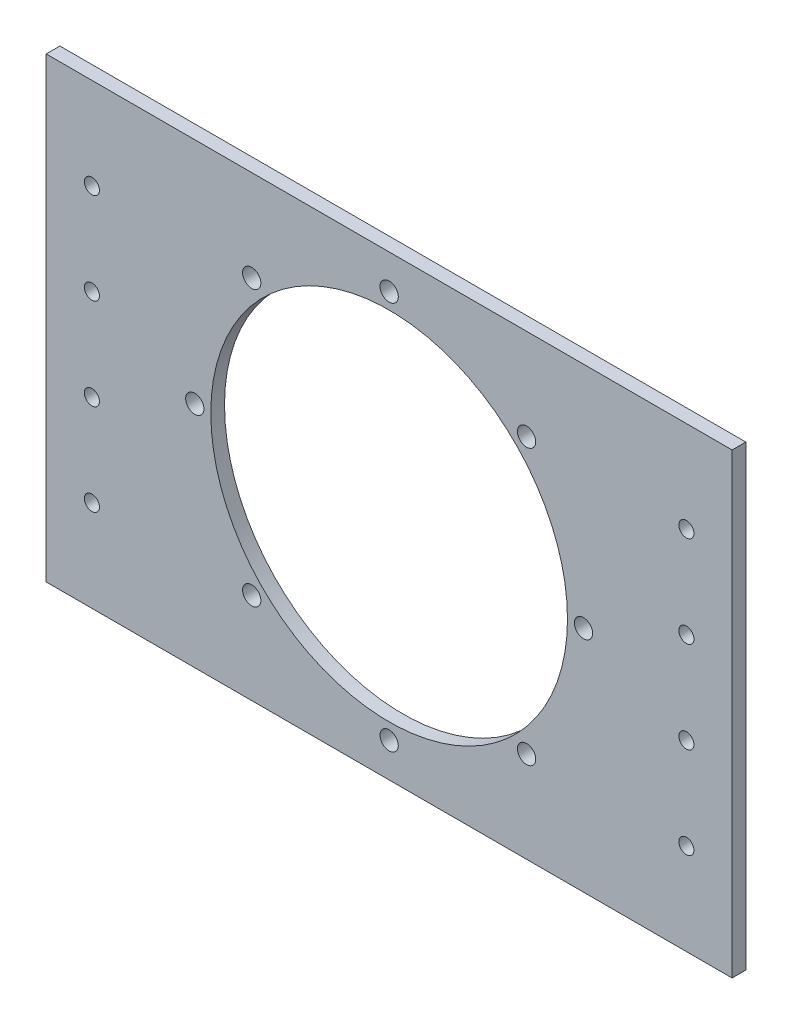
from build123d import *

# Parameters (mm, degrees)
SKETCH_1_W      = 150
SKETCH_1_H      = 100
SKETCH_1_R      = 39
SKETCH_1_R_2    = 2
SKETCH_1_R_3    = 1.65
EXTRUDE_1_DEPTH = 3


with BuildPart() as part:
    # 草图1 → 凸台-拉伸1 (new body)
    with BuildSketch(Plane.XY):
        Rectangle(SKETCH_1_W, SKETCH_1_H)
        Circle(SKETCH_1_R, mode=Mode.SUBTRACT)
        with Locations((42.5, 0)):
            Circle(SKETCH_1_R_2, mode=Mode.SUBTRACT)
        with Locations((30.0520382, -30.0520382)):
            Circle(SKETCH_1_R_2, mode=Mode.SUBTRACT)
        with Locations((0, -42.5)):
            Circle(SKETCH_1_R_2, mode=Mode.SUBTRACT)
        with Locations((-30.0520382, -30.0520382)):
            Circle(SKETCH_1_R_2, mode=Mode.SUBTRACT)
        with Locations((-42.5, 0)):
            Circle(SKETCH_1_R_2, mode=Mode.SUBTRACT)
        with Locations((-30.0520382, 30.0520382)):
            Circle(SKETCH_1_R_2, mode=Mode.SUBTRACT)
        with Locations((0, 42.5)):
            Circle(SKETCH_1_R_2, mode=Mode.SUBTRACT)
        with Locations((30.0520382, 30.0520382)):
            Circle(SKETCH_1_R_2, mode=Mode.SUBTRACT)
        with Locations((-65, 30)):
            Circle(SKETCH_1_R_3, mode=Mode.SUBTRACT)
        with Locations((-65, 10)):
            Circle(SKETCH_1_R_3, mode=Mode.SUBTRACT)
        with Locations((-65, -10)):
            Circle(SKETCH_1_R_3, mode=Mode.SUBTRACT)
        with Locations((-65, -30)):
            Circle(SKETCH_1_R_3, mode=Mode.SUBTRACT)
        with Locations((65, -30)):
            Circle(SKETCH_1_R_3, mode=Mode.SUBTRACT)
        with Locations((65, -10)):
            Circle(SKETCH_1_R_3, mode=Mode.SUBTRACT)
        with Locations((65, 10)):
            Circle(SKETCH_1_R_3, mode=Mode.SUBTRACT)
        with Locations((65, 30)):
            Circle(SKETCH_1_R_3, mode=Mode.SUBTRACT)
    extrude(amount=EXTRUDE_1_DEPTH)


solid = part.part
